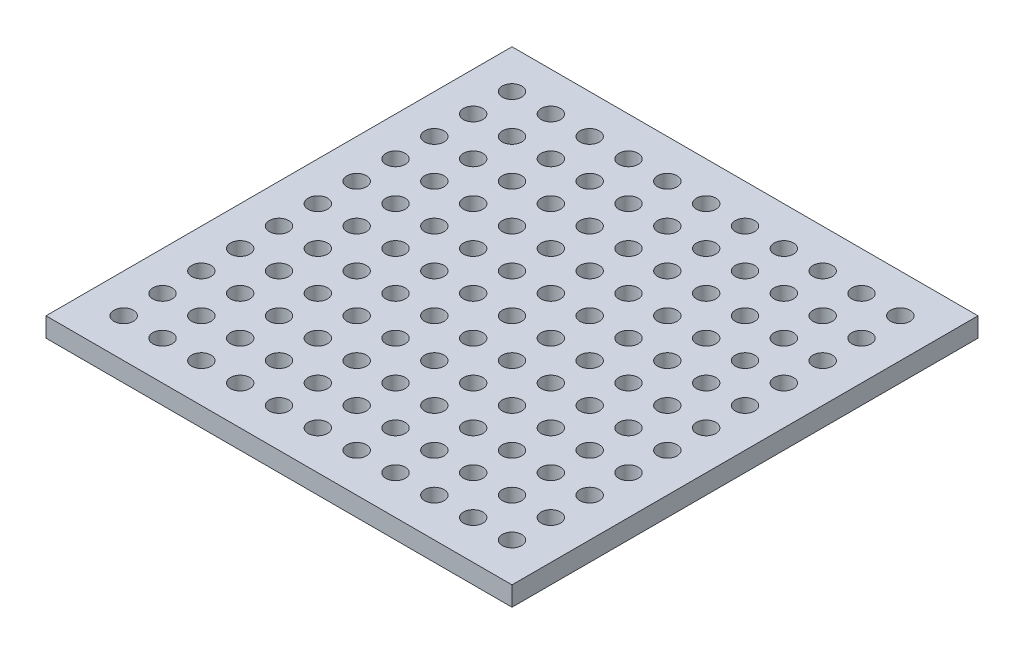
from build123d import *

# Parameters (mm, degrees)
SKETCH1_W        = 120
SKETCH1_H        = 5
MESH_BLOCK_DEPTH = 120
SKETCH2_R        = 2.5
MESH_HOLES_DEPTH = 170.779268463


with BuildPart() as part:
    # Sketch1 → Mesh Block (new body)
    with BuildSketch(Plane.XY):
        with Locations((60, 2.5)):
            Rectangle(SKETCH1_W, SKETCH1_H)
    extrude(amount=MESH_BLOCK_DEPTH)

    # Sketch2 → Mesh Holes (cut, through all)
    with BuildSketch(Plane(origin=(0, 5, 0), x_dir=(1, 0, 0), z_dir=(0, 1, 0))):
        with Locations((10, -10)):
            Circle(SKETCH2_R)
        with Locations((20, -10)):
            Circle(SKETCH2_R)
        with Locations((30, -10)):
            Circle(SKETCH2_R)
        with Locations((40, -10)):
            Circle(SKETCH2_R)
        with Locations((50, -10)):
            Circle(SKETCH2_R)
        with Locations((60, -10)):
            Circle(SKETCH2_R)
        with Locations((70, -10)):
            Circle(SKETCH2_R)
        with Locations((80, -10)):
            Circle(SKETCH2_R)
        with Locations((90, -10)):
            Circle(SKETCH2_R)
        with Locations((100, -10)):
            Circle(SKETCH2_R)
        with Locations((110, -10)):
            Circle(SKETCH2_R)
        with Locations((10, -20)):
            Circle(SKETCH2_R)
        with Locations((20, -20)):
            Circle(SKETCH2_R)
        with Locations((30, -20)):
            Circle(SKETCH2_R)
        with Locations((40, -20)):
            Circle(SKETCH2_R)
        with Locations((50, -20)):
            Circle(SKETCH2_R)
        with Locations((60, -20)):
            Circle(SKETCH2_R)
        with Locations((70, -20)):
            Circle(SKETCH2_R)
        with Locations((80, -20)):
            Circle(SKETCH2_R)
        with Locations((90, -20)):
            Circle(SKETCH2_R)
        with Locations((100, -20)):
            Circle(SKETCH2_R)
        with Locations((110, -20)):
            Circle(SKETCH2_R)
        with Locations((10, -30)):
            Circle(SKETCH2_R)
        with Locations((20, -30)):
            Circle(SKETCH2_R)
        with Locations((30, -30)):
            Circle(SKETCH2_R)
        with Locations((40, -30)):
            Circle(SKETCH2_R)
        with Locations((50, -30)):
            Circle(SKETCH2_R)
        with Locations((60, -30)):
            Circle(SKETCH2_R)
        with Locations((70, -30)):
            Circle(SKETCH2_R)
        with Locations((80, -30)):
            Circle(SKETCH2_R)
        with Locations((90, -30)):
            Circle(SKETCH2_R)
        with Locations((100, -30)):
            Circle(SKETCH2_R)
        with Locations((110, -30)):
            Circle(SKETCH2_R)
        with Locations((10, -40)):
            Circle(SKETCH2_R)
        with Locations((20, -40)):
            Circle(SKETCH2_R)
        with Locations((30, -40)):
            Circle(SKETCH2_R)
        with Locations((40, -40)):
            Circle(SKETCH2_R)
        with Locations((50, -40)):
            Circle(SKETCH2_R)
        with Locations((60, -40)):
            Circle(SKETCH2_R)
        with Locations((70, -40)):
            Circle(SKETCH2_R)
        with Locations((80, -40)):
            Circle(SKETCH2_R)
        with Locations((90, -40)):
            Circle(SKETCH2_R)
        with Locations((100, -40)):
            Circle(SKETCH2_R)
        with Locations((110, -40)):
            Circle(SKETCH2_R)
        with Locations((10, -50)):
            Circle(SKETCH2_R)
        with Locations((20, -50)):
            Circle(SKETCH2_R)
        with Locations((30, -50)):
            Circle(SKETCH2_R)
        with Locations((40, -50)):
            Circle(SKETCH2_R)
        with Locations((50, -50)):
            Circle(SKETCH2_R)
        with Locations((60, -50)):
            Circle(SKETCH2_R)
        with Locations((70, -50)):
            Circle(SKETCH2_R)
        with Locations((80, -50)):
            Circle(SKETCH2_R)
        with Locations((90, -50)):
            Circle(SKETCH2_R)
        with Locations((100, -50)):
            Circle(SKETCH2_R)
        with Locations((110, -50)):
            Circle(SKETCH2_R)
        with Locations((10, -60)):
            Circle(SKETCH2_R)
        with Locations((20, -60)):
            Circle(SKETCH2_R)
        with Locations((30, -60)):
            Circle(SKETCH2_R)
        with Locations((40, -60)):
            Circle(SKETCH2_R)
        with Locations((50, -60)):
            Circle(SKETCH2_R)
        with Locations((60, -60)):
            Circle(SKETCH2_R)
        with Locations((70, -60)):
            Circle(SKETCH2_R)
        with Locations((80, -60)):
            Circle(SKETCH2_R)
        with Locations((90, -60)):
            Circle(SKETCH2_R)
        with Locations((100, -60)):
            Circle(SKETCH2_R)
        with Locations((110, -60)):
            Circle(SKETCH2_R)
        with Locations((10, -70)):
            Circle(SKETCH2_R)
        with Locations((20, -70)):
            Circle(SKETCH2_R)
        with Locations((30, -70)):
            Circle(SKETCH2_R)
        with Locations((40, -70)):
            Circle(SKETCH2_R)
        with Locations((50, -70)):
            Circle(SKETCH2_R)
        with Locations((60, -70)):
            Circle(SKETCH2_R)
        with Locations((70, -70)):
            Circle(SKETCH2_R)
        with Locations((80, -70)):
            Circle(SKETCH2_R)
        with Locations((90, -70)):
            Circle(SKETCH2_R)
        with Locations((100, -70)):
            Circle(SKETCH2_R)
        with Locations((110, -70)):
            Circle(SKETCH2_R)
        with Locations((10, -80)):
            Circle(SKETCH2_R)
        with Locations((20, -80)):
            Circle(SKETCH2_R)
        with Locations((30, -80)):
            Circle(SKETCH2_R)
        with Locations((40, -80)):
            Circle(SKETCH2_R)
        with Locations((50, -80)):
            Circle(SKETCH2_R)
        with Locations((60, -80)):
            Circle(SKETCH2_R)
        with Locations((70, -80)):
            Circle(SKETCH2_R)
        with Locations((80, -80)):
            Circle(SKETCH2_R)
        with Locations((90, -80)):
            Circle(SKETCH2_R)
        with Locations((100, -80)):
            Circle(SKETCH2_R)
        with Locations((110, -80)):
            Circle(SKETCH2_R)
        with Locations((10, -90)):
            Circle(SKETCH2_R)
        with Locations((20, -90)):
            Circle(SKETCH2_R)
        with Locations((30, -90)):
            Circle(SKETCH2_R)
        with Locations((40, -90)):
            Circle(SKETCH2_R)
        with Locations((50, -90)):
            Circle(SKETCH2_R)
        with Locations((60, -90)):
            Circle(SKETCH2_R)
        with Locations((70, -90)):
            Circle(SKETCH2_R)
        with Locations((80, -90)):
            Circle(SKETCH2_R)
        with Locations((90, -90)):
            Circle(SKETCH2_R)
        with Locations((100, -90)):
            Circle(SKETCH2_R)
        with Locations((110, -90)):
            Circle(SKETCH2_R)
        with Locations((10, -100)):
            Circle(SKETCH2_R)
        with Locations((20, -100)):
            Circle(SKETCH2_R)
        with Locations((30, -100)):
            Circle(SKETCH2_R)
        with Locations((40, -100)):
            Circle(SKETCH2_R)
        with Locations((50, -100)):
            Circle(SKETCH2_R)
        with Locations((60, -100)):
            Circle(SKETCH2_R)
        with Locations((70, -100)):
            Circle(SKETCH2_R)
        with Locations((80, -100)):
            Circle(SKETCH2_R)
        with Locations((90, -100)):
            Circle(SKETCH2_R)
        with Locations((100, -100)):
            Circle(SKETCH2_R)
        with Locations((110, -100)):
            Circle(SKETCH2_R)
        with Locations((10, -110)):
            Circle(SKETCH2_R)
        with Locations((20, -110)):
            Circle(SKETCH2_R)
        with Locations((30, -110)):
            Circle(SKETCH2_R)
        with Locations((40, -110)):
            Circle(SKETCH2_R)
        with Locations((50, -110)):
            Circle(SKETCH2_R)
        with Locations((60, -110)):
            Circle(SKETCH2_R)
        with Locations((70, -110)):
            Circle(SKETCH2_R)
        with Locations((80, -110)):
            Circle(SKETCH2_R)
        with Locations((90, -110)):
            Circle(SKETCH2_R)
        with Locations((100, -110)):
            Circle(SKETCH2_R)
        with Locations((110, -110)):
            Circle(SKETCH2_R)
    extrude(amount=-MESH_HOLES_DEPTH, mode=Mode.SUBTRACT)


solid = part.part
